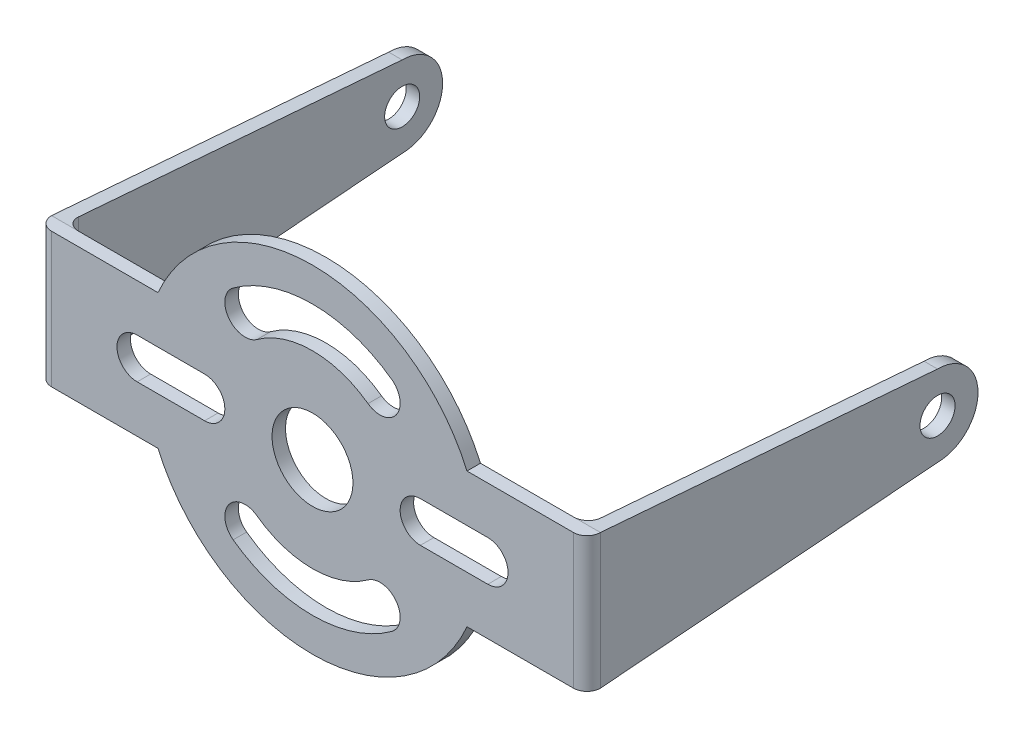
from build123d import *

# Parameters (mm, degrees)
SKETCH1_R           = 3
BOSS_EXTRUDE1_DEPTH = 1
SKETCH2_R           = 1.3
BOSS_EXTRUDE2_DEPTH = 1
FILLET1_R           = 1
CUT_EXTRUDE1_DEPTH  = 1


with BuildPart() as part:
    # Sketch1 → Boss-Extrude1 (new body)
    with BuildSketch(Plane.XY):
        with BuildLine():
            Line((-11.456439237, 5), (-20.35, 5))
            Line((-20.35, 5), (-20.35, -5))
            Line((-20.35, -5), (-11.456439237, -5))
            ThreePointArc((-11.456439237, -5), (0, -12.5), (11.456439237, -5))
            Line((11.456439237, -5), (20.35, -5))
            Line((20.35, -5), (20.35, 5))
            Line((20.35, 5), (11.456439237, 5))
            ThreePointArc((11.456439237, 5), (0, 12.5), (-11.456439237, 5))
        make_face()
        Circle(SKETCH1_R, mode=Mode.SUBTRACT)
    extrude(amount=BOSS_EXTRUDE1_DEPTH)

    # Sketch2 → Boss-Extrude2 (add)
    with BuildSketch(Plane.ZY.offset(20.35)):
        with BuildLine():
            Line((0, -5), (0, 5))
            Line((0, 5), (-25, 3))
            ThreePointArc((-25, 3), (-28, 0), (-25, -3))
            Line((-25, -3), (0, -5))
        make_face()
        with Locations((-25, 0)):
            Circle(SKETCH2_R, mode=Mode.SUBTRACT)
    boss_extrude2 = extrude(amount=-BOSS_EXTRUDE2_DEPTH)

    # Mirror1: Boss-Extrude2 across plane
    add(boss_extrude2.mirror(Plane.ZY))

    # Fillet1
    fillet1_edges = [part.edges().sort_by_distance(p)[0] for p in [
        (20.35, 0, 1),
        (19.35, 0, 0),
        (-20.35, 0, 1),
        (-19.35, 0, 0),
    ]]
    fillet(fillet1_edges, radius=FILLET1_R)

    # Sketch3 → Cut-Extrude1 (cut)
    with BuildSketch(Plane.XY.offset(1)):
        with BuildLine():
            ThreePointArc((8, 1.5), (6.5, 0), (8, -1.5))
            Line((8, -1.5), (13, -1.5))
            ThreePointArc((13, -1.5), (14.5, 0), (13, 1.5))
            Line((13, 1.5), (8, 1.5))
        make_face()
        with BuildLine():
            ThreePointArc((4.117647076, 5.660828787), (6.213034752, 5.991510614), (5.882352933, 8.086898291))
            ThreePointArc((5.882352933, 8.086898291), (6e-09, 10), (-5.882352923, 8.086898298))
            ThreePointArc((-5.882352923, 8.086898298), (-6.213034767, 5.991510634), (-4.117647107, 5.660828765))
            ThreePointArc((-4.117647107, 5.660828765), (-1.9e-08, 7), (4.117647076, 5.660828787))
        make_face()
        with BuildLine():
            ThreePointArc((4.117647035, -5.660828817), (-2.5e-08, -7), (-4.117647076, -5.660828787))
            ThreePointArc((-4.117647076, -5.660828787), (-6.213034774, -5.991510645), (-5.882352871, -8.086898336))
            ThreePointArc((-5.882352871, -8.086898336), (7.8e-08, -10), (5.882352997, -8.086898245))
            ThreePointArc((5.882352997, -8.086898245), (6.213034714, -5.991510562), (4.117647035, -5.660828817))
        make_face()
        with BuildLine():
            ThreePointArc((-8, -1.5), (-6.5, 0), (-8, 1.5))
            Line((-8, 1.5), (-13, 1.5))
            ThreePointArc((-13, 1.5), (-14.5, 0), (-13, -1.5))
            Line((-13, -1.5), (-8, -1.5))
        make_face()
    extrude(amount=-CUT_EXTRUDE1_DEPTH, mode=Mode.SUBTRACT)


solid = part.part
